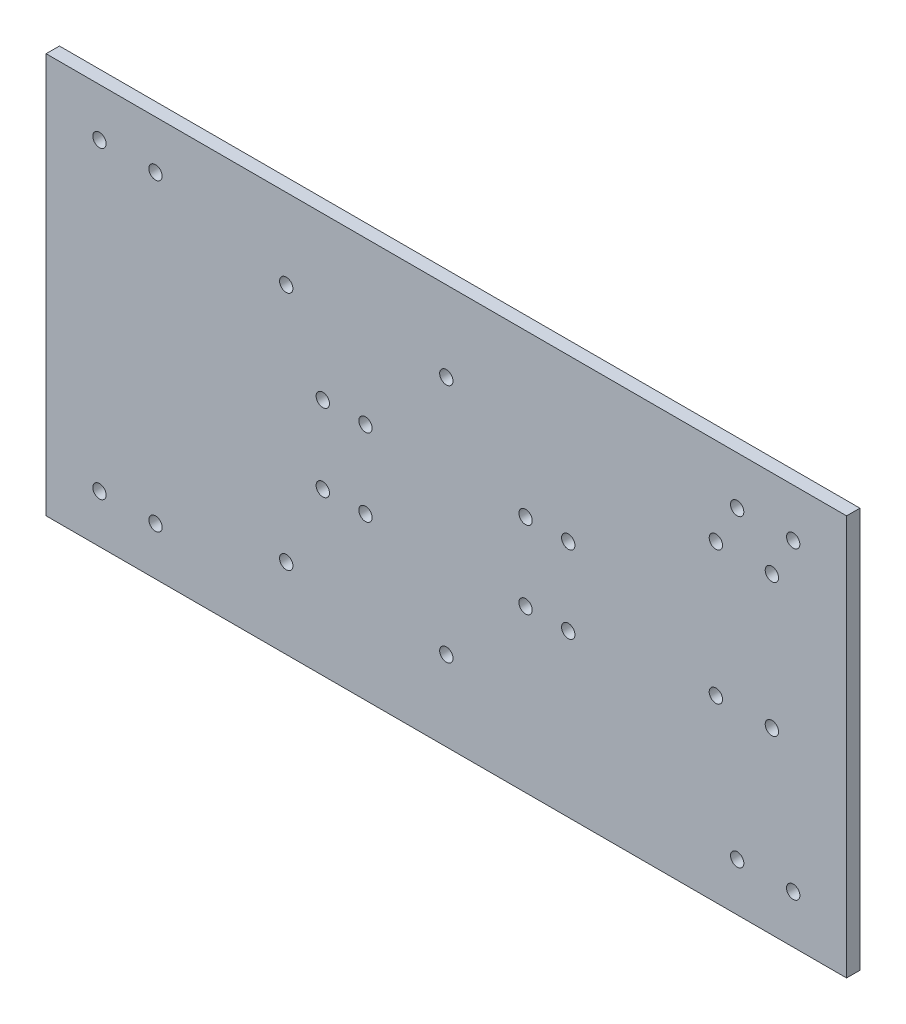
from build123d import *

# Parameters (mm, degrees)
ESQUISSE1_W             = 300
ESQUISSE1_H             = 150
ESQUISSE1_R             = 2.5
BOSS_EXTRU_1_DEPTH      = 5
ESQUISSE2_R             = 2.5
ENL_V_MAT_EXTRU_1_DEPTH = 10


with BuildPart() as part:
    # Esquisse1 → Boss.-Extru.1 (new body)
    with BuildSketch(Plane.XY):
        with Locations((150, 75)):
            Rectangle(ESQUISSE1_W, ESQUISSE1_H)
        with Locations((150, 30)):
            Circle(ESQUISSE1_R, mode=Mode.SUBTRACT)
        with Locations((150, 120)):
            Circle(ESQUISSE1_R, mode=Mode.SUBTRACT)
        with Locations((103.7, 89.5)):
            Circle(ESQUISSE1_R, mode=Mode.SUBTRACT)
        with Locations((103.7, 60.5)):
            Circle(ESQUISSE1_R, mode=Mode.SUBTRACT)
        with Locations((119.7, 89.5)):
            Circle(ESQUISSE1_R, mode=Mode.SUBTRACT)
        with Locations((119.7, 60.5)):
            Circle(ESQUISSE1_R, mode=Mode.SUBTRACT)
        with Locations((90, 120)):
            Circle(ESQUISSE1_R, mode=Mode.SUBTRACT)
        with Locations((90, 30)):
            Circle(ESQUISSE1_R, mode=Mode.SUBTRACT)
        with Locations((179.7, 89.5)):
            Circle(ESQUISSE1_R, mode=Mode.SUBTRACT)
        with Locations((179.7, 60.5)):
            Circle(ESQUISSE1_R, mode=Mode.SUBTRACT)
        with Locations((195.7, 89.5)):
            Circle(ESQUISSE1_R, mode=Mode.SUBTRACT)
        with Locations((195.7, 60.5)):
            Circle(ESQUISSE1_R, mode=Mode.SUBTRACT)
        with Locations((251.014019513, 67.15)):
            Circle(ESQUISSE1_R, mode=Mode.SUBTRACT)
        with Locations((272.014019513, 67.15)):
            Circle(ESQUISSE1_R, mode=Mode.SUBTRACT)
        with Locations((251.014019513, 117.15)):
            Circle(ESQUISSE1_R, mode=Mode.SUBTRACT)
        with Locations((272.014019513, 117.15)):
            Circle(ESQUISSE1_R, mode=Mode.SUBTRACT)
    extrude(amount=BOSS_EXTRU_1_DEPTH)

    # Esquisse2 → Enlèv. mat.-Extru.1 (cut)
    with BuildSketch(Plane.XY.offset(5)):
        with Locations((280, 132)):
            Circle(ESQUISSE2_R)
        with Locations((280, 18)):
            Circle(ESQUISSE2_R)
        with Locations((20, 132)):
            Circle(ESQUISSE2_R)
        with Locations((20, 18)):
            Circle(ESQUISSE2_R)
        with Locations((259, 132)):
            Circle(ESQUISSE2_R)
        with Locations((259, 18)):
            Circle(ESQUISSE2_R)
        with Locations((41, 18)):
            Circle(ESQUISSE2_R)
        with Locations((41, 132)):
            Circle(ESQUISSE2_R)
    extrude(amount=-ENL_V_MAT_EXTRU_1_DEPTH, mode=Mode.SUBTRACT)


solid = part.part
